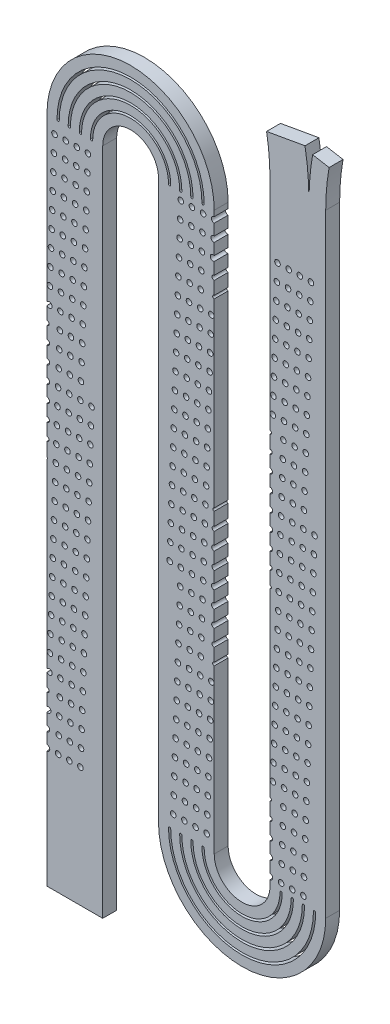
from build123d import *

# Parameters (mm, degrees)
MODEL_R             = 0.005
BOSS_EXTRUDE1_DEPTH = 0.025


with BuildPart() as part:
    # Model → Boss-Extrude1 (new body)
    with BuildSketch(Plane.XY):
        with BuildLine():
            Line((0, 0), (0, 0.01))
            ThreePointArc((0, 0.01), (0.005, 0.015), (0, 0.02))
            Line((0, 0.02), (0, 0.040110983))
            ThreePointArc((0, 0.040110983), (0.004889017, 0.045), (0, 0.049889017))
            Line((0, 0.049889017), (0, 0.070460182))
            ThreePointArc((0, 0.070460182), (0.007095246, 0.075), (0, 0.079539818))
            Line((0, 0.079539818), (0, 0.10111125))
            ThreePointArc((0, 0.10111125), (0.00388875, 0.105), (0, 0.10888875))
            Line((0, 0.10888875), (0, 0.132272405))
            ThreePointArc((0, 0.132272405), (0.009190492, 0.135), (0, 0.137727595))
            Line((0, 0.137727595), (0, 0.462424505))
            ThreePointArc((0, 0.462424505), (0.000714346, 0.465), (0, 0.467575495))
            Line((0, 0.467575495), (0, 0.491190124))
            ThreePointArc((0, 0.491190124), (0.003809876, 0.495), (0, 0.498809876))
            Line((0, 0.498809876), (0, 0.520505324))
            ThreePointArc((0, 0.520505324), (0.004494676, 0.525), (0, 0.529494676))
            Line((0, 0.529494676), (0, 0.550132347))
            ThreePointArc((0, 0.550132347), (0.004867653, 0.555), (0, 0.559867653))
            Line((0, 0.559867653), (0, 0.580000906))
            ThreePointArc((0, 0.580000906), (0.004999094, 0.585), (0, 0.589999094))
            Line((0, 0.589999094), (0, 0.610091557))
            ThreePointArc((0, 0.610091557), (0.004908443, 0.615), (0, 0.619908443))
            Line((0, 0.619908443), (0, 0.640417461))
            ThreePointArc((0, 0.640417461), (0.004582539, 0.645), (0, 0.649582539))
            Line((0, 0.649582539), (0, 0.671036229))
            ThreePointArc((0, 0.671036229), (0.003963771, 0.675), (0, 0.678963771))
            Line((0, 0.678963771), (0, 0.702131505))
            ThreePointArc((0, 0.702131505), (0.009095331, 0.705), (0, 0.707868495))
            Line((0, 0.707868495), (0, 1))
            ThreePointArc((0, 1), (0.15, 1.15), (0.3, 1))
            Line((0.3, 1), (0.3, 0.99))
            ThreePointArc((0.3, 0.99), (0.295, 0.985), (0.3, 0.98))
            Line((0.3, 0.98), (0.3, 0.959889017))
            ThreePointArc((0.3, 0.959889017), (0.293952377, 0.955), (0.3, 0.950110983))
            Line((0.3, 0.950110983), (0.3, 0.929539818))
            ThreePointArc((0.3, 0.929539818), (0.292904754, 0.925), (0.3, 0.920460182))
            Line((0.3, 0.920460182), (0.3, 0.89888875))
            ThreePointArc((0.3, 0.89888875), (0.29611125, 0.895), (0.3, 0.89111125))
            Line((0.3, 0.89111125), (0.3, 0.867727595))
            ThreePointArc((0.3, 0.867727595), (0.297272405, 0.865), (0.3, 0.862272405))
            Line((0.3, 0.862272405), (0.3, 0.537575495))
            ThreePointArc((0.3, 0.537575495), (0.297424505, 0.535), (0.3, 0.532424505))
            Line((0.3, 0.532424505), (0.3, 0.508809876))
            ThreePointArc((0.3, 0.508809876), (0.296190124, 0.505), (0.3, 0.501190124))
            Line((0.3, 0.501190124), (0.3, 0.479494676))
            ThreePointArc((0.3, 0.479494676), (0.295505324, 0.475), (0.3, 0.470505324))
            Line((0.3, 0.470505324), (0.3, 0.449867653))
            ThreePointArc((0.3, 0.449867653), (0.296142784, 0.445), (0.3, 0.440132347))
            Line((0.3, 0.440132347), (0.3, 0.419999094))
            ThreePointArc((0.3, 0.419999094), (0.295000906, 0.415), (0.3, 0.410000906))
            Line((0.3, 0.410000906), (0.3, 0.389908443))
            ThreePointArc((0.3, 0.389908443), (0.295091557, 0.385), (0.3, 0.380091557))
            Line((0.3, 0.380091557), (0.3, 0.359582539))
            ThreePointArc((0.3, 0.359582539), (0.295417461, 0.355), (0.3, 0.350417461))
            Line((0.3, 0.350417461), (0.3, 0.328963771))
            ThreePointArc((0.3, 0.328963771), (0.296036229, 0.325), (0.3, 0.321036229))
            Line((0.3, 0.321036229), (0.3, 0.297868495))
            ThreePointArc((0.3, 0.297868495), (0.297131505, 0.295), (0.3, 0.292131505))
            Line((0.3, 0.292131505), (0.3, 0))
            ThreePointArc((0.3, 0), (0.35, -0.05), (0.4, 0))
            Line((0.4, 0), (0.4, 0.01))
            ThreePointArc((0.4, 0.01), (0.405, 0.015), (0.4, 0.02))
            Line((0.4, 0.02), (0.4, 0.040110983))
            ThreePointArc((0.4, 0.040110983), (0.404889017, 0.045), (0.4, 0.049889017))
            Line((0.4, 0.049889017), (0.4, 0.070460182))
            ThreePointArc((0.4, 0.070460182), (0.404539818, 0.075), (0.4, 0.079539818))
            Line((0.4, 0.079539818), (0.4, 0.10111125))
            ThreePointArc((0.4, 0.10111125), (0.40388875, 0.105), (0.4, 0.10888875))
            Line((0.4, 0.10888875), (0.4, 0.132272405))
            ThreePointArc((0.4, 0.132272405), (0.402727595, 0.135), (0.4, 0.137727595))
            Line((0.4, 0.137727595), (0.4, 0.462424505))
            ThreePointArc((0.4, 0.462424505), (0.402575495, 0.465), (0.4, 0.467575495))
            Line((0.4, 0.467575495), (0.4, 0.491190124))
            ThreePointArc((0.4, 0.491190124), (0.403809876, 0.495), (0.4, 0.498809876))
            Line((0.4, 0.498809876), (0.4, 0.520505324))
            ThreePointArc((0.4, 0.520505324), (0.404494676, 0.525), (0.4, 0.529494676))
            Line((0.4, 0.529494676), (0.4, 0.550132347))
            ThreePointArc((0.4, 0.550132347), (0.404867653, 0.555), (0.4, 0.559867653))
            Line((0.4, 0.559867653), (0.4, 0.580000906))
            ThreePointArc((0.4, 0.580000906), (0.404904839, 0.585), (0.4, 0.589999094))
            Line((0.4, 0.589999094), (0.4, 0.610091557))
            ThreePointArc((0.4, 0.610091557), (0.404908443, 0.615), (0.4, 0.619908443))
            Line((0.4, 0.619908443), (0.4, 0.640417461))
            ThreePointArc((0.4, 0.640417461), (0.404582539, 0.645), (0.4, 0.649582539))
            Line((0.4, 0.649582539), (0.4, 0.671036229))
            ThreePointArc((0.4, 0.671036229), (0.403963771, 0.675), (0.4, 0.678963771))
            Line((0.4, 0.678963771), (0.4, 0.702131505))
            ThreePointArc((0.4, 0.702131505), (0.402868495, 0.705), (0.4, 0.707868495))
            Line((0.4, 0.707868495), (0.4, 1))
            Line((0.4, 1), (0.4, 1.1))
            ThreePointArc((0.4, 1.1), (0.398477879, 1.134862297), (0.393923101, 1.169459271))
            Line((0.393923101, 1.169459271), (0.462859644, 1.181614644))
            ThreePointArc((0.462859644, 1.181614644), (0.468211508, 1.140963199), (0.47, 1.1))
            ThreePointArc((0.47, 1.1), (0.47163628, 1.137476969), (0.476532666, 1.174668716))
            Line((0.476532666, 1.174668716), (0.506076899, 1.169459271))
            ThreePointArc((0.506076899, 1.169459271), (0.501522121, 1.134862297), (0.5, 1.1))
            Line((0.5, 1.1), (0.5, 1))
            Line((0.5, 1), (0.5, 0))
            ThreePointArc((0.5, 0), (0.35, -0.15), (0.2, 0))
            Line((0.2, 0), (0.2, 1))
            ThreePointArc((0.2, 1), (0.15, 1.05), (0.1, 1))
            Line((0.1, 1), (0.1, 0))
            Line((0.1, 0), (0.1, -0.2))
            Line((0.1, -0.2), (0, -0.2))
            Line((0, -0.2), (0, 0))
        make_face()
        with Locations((0.02, 0.015)):
            Circle(MODEL_R, mode=Mode.SUBTRACT)
        with Locations((0.04, 0.015)):
            Circle(MODEL_R, mode=Mode.SUBTRACT)
        with Locations((0.06, 0.015)):
            Circle(MODEL_R, mode=Mode.SUBTRACT)
        with Locations((0.021047623, 0.045)):
            Circle(MODEL_R, mode=Mode.SUBTRACT)
        with Locations((0.041047623, 0.045)):
            Circle(MODEL_R, mode=Mode.SUBTRACT)
        with Locations((0.061047623, 0.045)):
            Circle(MODEL_R, mode=Mode.SUBTRACT)
        with Locations((0.022095246, 0.075)):
            Circle(MODEL_R, mode=Mode.SUBTRACT)
        with Locations((0.042095246, 0.075)):
            Circle(MODEL_R, mode=Mode.SUBTRACT)
        with Locations((0.062095246, 0.075)):
            Circle(MODEL_R, mode=Mode.SUBTRACT)
        with Locations((0.023142869, 0.105)):
            Circle(MODEL_R, mode=Mode.SUBTRACT)
        with Locations((0.043142869, 0.105)):
            Circle(MODEL_R, mode=Mode.SUBTRACT)
        with Locations((0.063142869, 0.105)):
            Circle(MODEL_R, mode=Mode.SUBTRACT)
        with Locations((0.024190492, 0.135)):
            Circle(MODEL_R, mode=Mode.SUBTRACT)
        with Locations((0.044190492, 0.135)):
            Circle(MODEL_R, mode=Mode.SUBTRACT)
        with Locations((0.064190492, 0.135)):
            Circle(MODEL_R, mode=Mode.SUBTRACT)
        with Locations((0.005238115, 0.165)):
            Circle(MODEL_R, mode=Mode.SUBTRACT)
        with Locations((0.025238115, 0.165)):
            Circle(MODEL_R, mode=Mode.SUBTRACT)
        with Locations((0.045238115, 0.165)):
            Circle(MODEL_R, mode=Mode.SUBTRACT)
        with Locations((0.065238115, 0.165)):
            Circle(MODEL_R, mode=Mode.SUBTRACT)
        with Locations((0.006285739, 0.195)):
            Circle(MODEL_R, mode=Mode.SUBTRACT)
        with Locations((0.026285739, 0.195)):
            Circle(MODEL_R, mode=Mode.SUBTRACT)
        with Locations((0.046285739, 0.195)):
            Circle(MODEL_R, mode=Mode.SUBTRACT)
        with Locations((0.066285739, 0.195)):
            Circle(MODEL_R, mode=Mode.SUBTRACT)
        with Locations((0.007333362, 0.225)):
            Circle(MODEL_R, mode=Mode.SUBTRACT)
        with Locations((0.027333362, 0.225)):
            Circle(MODEL_R, mode=Mode.SUBTRACT)
        with Locations((0.047333362, 0.225)):
            Circle(MODEL_R, mode=Mode.SUBTRACT)
        with Locations((0.067333362, 0.225)):
            Circle(MODEL_R, mode=Mode.SUBTRACT)
        with Locations((0.008380985, 0.255)):
            Circle(MODEL_R, mode=Mode.SUBTRACT)
        with Locations((0.028380985, 0.255)):
            Circle(MODEL_R, mode=Mode.SUBTRACT)
        with Locations((0.048380985, 0.255)):
            Circle(MODEL_R, mode=Mode.SUBTRACT)
        with Locations((0.068380985, 0.255)):
            Circle(MODEL_R, mode=Mode.SUBTRACT)
        with Locations((0.009428608, 0.285)):
            Circle(MODEL_R, mode=Mode.SUBTRACT)
        with Locations((0.029428608, 0.285)):
            Circle(MODEL_R, mode=Mode.SUBTRACT)
        with Locations((0.049428608, 0.285)):
            Circle(MODEL_R, mode=Mode.SUBTRACT)
        with Locations((0.069428608, 0.285)):
            Circle(MODEL_R, mode=Mode.SUBTRACT)
        with Locations((0.010476231, 0.315)):
            Circle(MODEL_R, mode=Mode.SUBTRACT)
        with Locations((0.030476231, 0.315)):
            Circle(MODEL_R, mode=Mode.SUBTRACT)
        with Locations((0.050476231, 0.315)):
            Circle(MODEL_R, mode=Mode.SUBTRACT)
        with Locations((0.070476231, 0.315)):
            Circle(MODEL_R, mode=Mode.SUBTRACT)
        with Locations((0.011523854, 0.345)):
            Circle(MODEL_R, mode=Mode.SUBTRACT)
        with Locations((0.031523854, 0.345)):
            Circle(MODEL_R, mode=Mode.SUBTRACT)
        with Locations((0.051523854, 0.345)):
            Circle(MODEL_R, mode=Mode.SUBTRACT)
        with Locations((0.071523854, 0.345)):
            Circle(MODEL_R, mode=Mode.SUBTRACT)
        with Locations((0.012571477, 0.375)):
            Circle(MODEL_R, mode=Mode.SUBTRACT)
        with Locations((0.032571477, 0.375)):
            Circle(MODEL_R, mode=Mode.SUBTRACT)
        with Locations((0.052571477, 0.375)):
            Circle(MODEL_R, mode=Mode.SUBTRACT)
        with Locations((0.072571477, 0.375)):
            Circle(MODEL_R, mode=Mode.SUBTRACT)
        with Locations((0.0136191, 0.405)):
            Circle(MODEL_R, mode=Mode.SUBTRACT)
        with Locations((0.0336191, 0.405)):
            Circle(MODEL_R, mode=Mode.SUBTRACT)
        with Locations((0.0536191, 0.405)):
            Circle(MODEL_R, mode=Mode.SUBTRACT)
        with Locations((0.0736191, 0.405)):
            Circle(MODEL_R, mode=Mode.SUBTRACT)
        with Locations((0.014666723, 0.435)):
            Circle(MODEL_R, mode=Mode.SUBTRACT)
        with Locations((0.034666723, 0.435)):
            Circle(MODEL_R, mode=Mode.SUBTRACT)
        with Locations((0.054666723, 0.435)):
            Circle(MODEL_R, mode=Mode.SUBTRACT)
        with Locations((0.074666723, 0.435)):
            Circle(MODEL_R, mode=Mode.SUBTRACT)
        with Locations((0.015714346, 0.465)):
            Circle(MODEL_R, mode=Mode.SUBTRACT)
        with Locations((0.035714346, 0.465)):
            Circle(MODEL_R, mode=Mode.SUBTRACT)
        with Locations((0.055714346, 0.465)):
            Circle(MODEL_R, mode=Mode.SUBTRACT)
        with Locations((0.075714346, 0.465)):
            Circle(MODEL_R, mode=Mode.SUBTRACT)
        with Locations((0.016761969, 0.495)):
            Circle(MODEL_R, mode=Mode.SUBTRACT)
        with Locations((0.036761969, 0.495)):
            Circle(MODEL_R, mode=Mode.SUBTRACT)
        with Locations((0.056761969, 0.495)):
            Circle(MODEL_R, mode=Mode.SUBTRACT)
        with Locations((0.076761969, 0.495)):
            Circle(MODEL_R, mode=Mode.SUBTRACT)
        with Locations((0.017809592, 0.525)):
            Circle(MODEL_R, mode=Mode.SUBTRACT)
        with Locations((0.037809592, 0.525)):
            Circle(MODEL_R, mode=Mode.SUBTRACT)
        with Locations((0.057809592, 0.525)):
            Circle(MODEL_R, mode=Mode.SUBTRACT)
        with Locations((0.077809592, 0.525)):
            Circle(MODEL_R, mode=Mode.SUBTRACT)
        with Locations((0.018857216, 0.555)):
            Circle(MODEL_R, mode=Mode.SUBTRACT)
        with Locations((0.038857216, 0.555)):
            Circle(MODEL_R, mode=Mode.SUBTRACT)
        with Locations((0.058857216, 0.555)):
            Circle(MODEL_R, mode=Mode.SUBTRACT)
        with Locations((0.078857216, 0.555)):
            Circle(MODEL_R, mode=Mode.SUBTRACT)
        with Locations((0.019904839, 0.585)):
            Circle(MODEL_R, mode=Mode.SUBTRACT)
        with Locations((0.039904839, 0.585)):
            Circle(MODEL_R, mode=Mode.SUBTRACT)
        with Locations((0.059904839, 0.585)):
            Circle(MODEL_R, mode=Mode.SUBTRACT)
        with Locations((0.079904839, 0.585)):
            Circle(MODEL_R, mode=Mode.SUBTRACT)
        with Locations((0.020952462, 0.615)):
            Circle(MODEL_R, mode=Mode.SUBTRACT)
        with Locations((0.040952462, 0.615)):
            Circle(MODEL_R, mode=Mode.SUBTRACT)
        with Locations((0.060952462, 0.615)):
            Circle(MODEL_R, mode=Mode.SUBTRACT)
        with Locations((0.022000085, 0.645)):
            Circle(MODEL_R, mode=Mode.SUBTRACT)
        with Locations((0.042000085, 0.645)):
            Circle(MODEL_R, mode=Mode.SUBTRACT)
        with Locations((0.062000085, 0.645)):
            Circle(MODEL_R, mode=Mode.SUBTRACT)
        with Locations((0.023047708, 0.675)):
            Circle(MODEL_R, mode=Mode.SUBTRACT)
        with Locations((0.043047708, 0.675)):
            Circle(MODEL_R, mode=Mode.SUBTRACT)
        with Locations((0.063047708, 0.675)):
            Circle(MODEL_R, mode=Mode.SUBTRACT)
        with Locations((0.024095331, 0.705)):
            Circle(MODEL_R, mode=Mode.SUBTRACT)
        with Locations((0.044095331, 0.705)):
            Circle(MODEL_R, mode=Mode.SUBTRACT)
        with Locations((0.064095331, 0.705)):
            Circle(MODEL_R, mode=Mode.SUBTRACT)
        with Locations((0.005142954, 0.735)):
            Circle(MODEL_R, mode=Mode.SUBTRACT)
        with Locations((0.025142954, 0.735)):
            Circle(MODEL_R, mode=Mode.SUBTRACT)
        with Locations((0.045142954, 0.735)):
            Circle(MODEL_R, mode=Mode.SUBTRACT)
        with Locations((0.065142954, 0.735)):
            Circle(MODEL_R, mode=Mode.SUBTRACT)
        with Locations((0.006190577, 0.765)):
            Circle(MODEL_R, mode=Mode.SUBTRACT)
        with Locations((0.026190577, 0.765)):
            Circle(MODEL_R, mode=Mode.SUBTRACT)
        with Locations((0.046190577, 0.765)):
            Circle(MODEL_R, mode=Mode.SUBTRACT)
        with Locations((0.066190577, 0.765)):
            Circle(MODEL_R, mode=Mode.SUBTRACT)
        with Locations((0.0072382, 0.795)):
            Circle(MODEL_R, mode=Mode.SUBTRACT)
        with Locations((0.0272382, 0.795)):
            Circle(MODEL_R, mode=Mode.SUBTRACT)
        with Locations((0.0472382, 0.795)):
            Circle(MODEL_R, mode=Mode.SUBTRACT)
        with Locations((0.0672382, 0.795)):
            Circle(MODEL_R, mode=Mode.SUBTRACT)
        with Locations((0.008285823, 0.825)):
            Circle(MODEL_R, mode=Mode.SUBTRACT)
        with Locations((0.028285823, 0.825)):
            Circle(MODEL_R, mode=Mode.SUBTRACT)
        with Locations((0.048285823, 0.825)):
            Circle(MODEL_R, mode=Mode.SUBTRACT)
        with Locations((0.068285823, 0.825)):
            Circle(MODEL_R, mode=Mode.SUBTRACT)
        with Locations((0.009333446, 0.855)):
            Circle(MODEL_R, mode=Mode.SUBTRACT)
        with Locations((0.029333446, 0.855)):
            Circle(MODEL_R, mode=Mode.SUBTRACT)
        with Locations((0.049333446, 0.855)):
            Circle(MODEL_R, mode=Mode.SUBTRACT)
        with Locations((0.069333446, 0.855)):
            Circle(MODEL_R, mode=Mode.SUBTRACT)
        with Locations((0.010381069, 0.885)):
            Circle(MODEL_R, mode=Mode.SUBTRACT)
        with Locations((0.030381069, 0.885)):
            Circle(MODEL_R, mode=Mode.SUBTRACT)
        with Locations((0.050381069, 0.885)):
            Circle(MODEL_R, mode=Mode.SUBTRACT)
        with Locations((0.070381069, 0.885)):
            Circle(MODEL_R, mode=Mode.SUBTRACT)
        with Locations((0.011428693, 0.915)):
            Circle(MODEL_R, mode=Mode.SUBTRACT)
        with Locations((0.031428693, 0.915)):
            Circle(MODEL_R, mode=Mode.SUBTRACT)
        with Locations((0.051428693, 0.915)):
            Circle(MODEL_R, mode=Mode.SUBTRACT)
        with Locations((0.071428693, 0.915)):
            Circle(MODEL_R, mode=Mode.SUBTRACT)
        with Locations((0.012476316, 0.945)):
            Circle(MODEL_R, mode=Mode.SUBTRACT)
        with Locations((0.032476316, 0.945)):
            Circle(MODEL_R, mode=Mode.SUBTRACT)
        with Locations((0.052476316, 0.945)):
            Circle(MODEL_R, mode=Mode.SUBTRACT)
        with Locations((0.072476316, 0.945)):
            Circle(MODEL_R, mode=Mode.SUBTRACT)
        with Locations((0.013523939, 0.975)):
            Circle(MODEL_R, mode=Mode.SUBTRACT)
        with Locations((0.033523939, 0.975)):
            Circle(MODEL_R, mode=Mode.SUBTRACT)
        with Locations((0.053523939, 0.975)):
            Circle(MODEL_R, mode=Mode.SUBTRACT)
        with Locations((0.073523939, 0.975)):
            Circle(MODEL_R, mode=Mode.SUBTRACT)
        with Locations((0.28, 0.985)):
            Circle(MODEL_R, mode=Mode.SUBTRACT)
        with Locations((0.26, 0.985)):
            Circle(MODEL_R, mode=Mode.SUBTRACT)
        with Locations((0.24, 0.985)):
            Circle(MODEL_R, mode=Mode.SUBTRACT)
        with Locations((0.278952377, 0.955)):
            Circle(MODEL_R, mode=Mode.SUBTRACT)
        with Locations((0.258952377, 0.955)):
            Circle(MODEL_R, mode=Mode.SUBTRACT)
        with Locations((0.238952377, 0.955)):
            Circle(MODEL_R, mode=Mode.SUBTRACT)
        with Locations((0.277904754, 0.925)):
            Circle(MODEL_R, mode=Mode.SUBTRACT)
        with Locations((0.257904754, 0.925)):
            Circle(MODEL_R, mode=Mode.SUBTRACT)
        with Locations((0.237904754, 0.925)):
            Circle(MODEL_R, mode=Mode.SUBTRACT)
        with Locations((0.276857131, 0.895)):
            Circle(MODEL_R, mode=Mode.SUBTRACT)
        with Locations((0.256857131, 0.895)):
            Circle(MODEL_R, mode=Mode.SUBTRACT)
        with Locations((0.236857131, 0.895)):
            Circle(MODEL_R, mode=Mode.SUBTRACT)
        with Locations((0.275809508, 0.865)):
            Circle(MODEL_R, mode=Mode.SUBTRACT)
        with Locations((0.255809508, 0.865)):
            Circle(MODEL_R, mode=Mode.SUBTRACT)
        with Locations((0.235809508, 0.865)):
            Circle(MODEL_R, mode=Mode.SUBTRACT)
        with Locations((0.294761885, 0.835)):
            Circle(MODEL_R, mode=Mode.SUBTRACT)
        with Locations((0.274761885, 0.835)):
            Circle(MODEL_R, mode=Mode.SUBTRACT)
        with Locations((0.254761885, 0.835)):
            Circle(MODEL_R, mode=Mode.SUBTRACT)
        with Locations((0.234761885, 0.835)):
            Circle(MODEL_R, mode=Mode.SUBTRACT)
        with Locations((0.293714261, 0.805)):
            Circle(MODEL_R, mode=Mode.SUBTRACT)
        with Locations((0.273714261, 0.805)):
            Circle(MODEL_R, mode=Mode.SUBTRACT)
        with Locations((0.253714261, 0.805)):
            Circle(MODEL_R, mode=Mode.SUBTRACT)
        with Locations((0.233714261, 0.805)):
            Circle(MODEL_R, mode=Mode.SUBTRACT)
        with Locations((0.292666638, 0.775)):
            Circle(MODEL_R, mode=Mode.SUBTRACT)
        with Locations((0.272666638, 0.775)):
            Circle(MODEL_R, mode=Mode.SUBTRACT)
        with Locations((0.252666638, 0.775)):
            Circle(MODEL_R, mode=Mode.SUBTRACT)
        with Locations((0.232666638, 0.775)):
            Circle(MODEL_R, mode=Mode.SUBTRACT)
        with Locations((0.291619015, 0.745)):
            Circle(MODEL_R, mode=Mode.SUBTRACT)
        with Locations((0.271619015, 0.745)):
            Circle(MODEL_R, mode=Mode.SUBTRACT)
        with Locations((0.251619015, 0.745)):
            Circle(MODEL_R, mode=Mode.SUBTRACT)
        with Locations((0.231619015, 0.745)):
            Circle(MODEL_R, mode=Mode.SUBTRACT)
        with Locations((0.290571392, 0.715)):
            Circle(MODEL_R, mode=Mode.SUBTRACT)
        with Locations((0.270571392, 0.715)):
            Circle(MODEL_R, mode=Mode.SUBTRACT)
        with Locations((0.250571392, 0.715)):
            Circle(MODEL_R, mode=Mode.SUBTRACT)
        with Locations((0.230571392, 0.715)):
            Circle(MODEL_R, mode=Mode.SUBTRACT)
        with Locations((0.289523769, 0.685)):
            Circle(MODEL_R, mode=Mode.SUBTRACT)
        with Locations((0.269523769, 0.685)):
            Circle(MODEL_R, mode=Mode.SUBTRACT)
        with Locations((0.249523769, 0.685)):
            Circle(MODEL_R, mode=Mode.SUBTRACT)
        with Locations((0.229523769, 0.685)):
            Circle(MODEL_R, mode=Mode.SUBTRACT)
        with Locations((0.288476146, 0.655)):
            Circle(MODEL_R, mode=Mode.SUBTRACT)
        with Locations((0.268476146, 0.655)):
            Circle(MODEL_R, mode=Mode.SUBTRACT)
        with Locations((0.248476146, 0.655)):
            Circle(MODEL_R, mode=Mode.SUBTRACT)
        with Locations((0.228476146, 0.655)):
            Circle(MODEL_R, mode=Mode.SUBTRACT)
        with Locations((0.287428523, 0.625)):
            Circle(MODEL_R, mode=Mode.SUBTRACT)
        with Locations((0.267428523, 0.625)):
            Circle(MODEL_R, mode=Mode.SUBTRACT)
        with Locations((0.247428523, 0.625)):
            Circle(MODEL_R, mode=Mode.SUBTRACT)
        with Locations((0.227428523, 0.625)):
            Circle(MODEL_R, mode=Mode.SUBTRACT)
        with Locations((0.2863809, 0.595)):
            Circle(MODEL_R, mode=Mode.SUBTRACT)
        with Locations((0.2663809, 0.595)):
            Circle(MODEL_R, mode=Mode.SUBTRACT)
        with Locations((0.2463809, 0.595)):
            Circle(MODEL_R, mode=Mode.SUBTRACT)
        with Locations((0.2263809, 0.595)):
            Circle(MODEL_R, mode=Mode.SUBTRACT)
        with Locations((0.285333277, 0.565)):
            Circle(MODEL_R, mode=Mode.SUBTRACT)
        with Locations((0.265333277, 0.565)):
            Circle(MODEL_R, mode=Mode.SUBTRACT)
        with Locations((0.245333277, 0.565)):
            Circle(MODEL_R, mode=Mode.SUBTRACT)
        with Locations((0.225333277, 0.565)):
            Circle(MODEL_R, mode=Mode.SUBTRACT)
        with Locations((0.284285654, 0.535)):
            Circle(MODEL_R, mode=Mode.SUBTRACT)
        with Locations((0.264285654, 0.535)):
            Circle(MODEL_R, mode=Mode.SUBTRACT)
        with Locations((0.244285654, 0.535)):
            Circle(MODEL_R, mode=Mode.SUBTRACT)
        with Locations((0.224285654, 0.535)):
            Circle(MODEL_R, mode=Mode.SUBTRACT)
        with Locations((0.283238031, 0.505)):
            Circle(MODEL_R, mode=Mode.SUBTRACT)
        with Locations((0.263238031, 0.505)):
            Circle(MODEL_R, mode=Mode.SUBTRACT)
        with Locations((0.243238031, 0.505)):
            Circle(MODEL_R, mode=Mode.SUBTRACT)
        with Locations((0.223238031, 0.505)):
            Circle(MODEL_R, mode=Mode.SUBTRACT)
        with Locations((0.282190408, 0.475)):
            Circle(MODEL_R, mode=Mode.SUBTRACT)
        with Locations((0.262190408, 0.475)):
            Circle(MODEL_R, mode=Mode.SUBTRACT)
        with Locations((0.242190408, 0.475)):
            Circle(MODEL_R, mode=Mode.SUBTRACT)
        with Locations((0.222190408, 0.475)):
            Circle(MODEL_R, mode=Mode.SUBTRACT)
        with Locations((0.281142784, 0.445)):
            Circle(MODEL_R, mode=Mode.SUBTRACT)
        with Locations((0.261142784, 0.445)):
            Circle(MODEL_R, mode=Mode.SUBTRACT)
        with Locations((0.241142784, 0.445)):
            Circle(MODEL_R, mode=Mode.SUBTRACT)
        with Locations((0.221142784, 0.445)):
            Circle(MODEL_R, mode=Mode.SUBTRACT)
        with Locations((0.280095161, 0.415)):
            Circle(MODEL_R, mode=Mode.SUBTRACT)
        with Locations((0.260095161, 0.415)):
            Circle(MODEL_R, mode=Mode.SUBTRACT)
        with Locations((0.240095161, 0.415)):
            Circle(MODEL_R, mode=Mode.SUBTRACT)
        with Locations((0.220095161, 0.415)):
            Circle(MODEL_R, mode=Mode.SUBTRACT)
        with Locations((0.279047538, 0.385)):
            Circle(MODEL_R, mode=Mode.SUBTRACT)
        with Locations((0.259047538, 0.385)):
            Circle(MODEL_R, mode=Mode.SUBTRACT)
        with Locations((0.239047538, 0.385)):
            Circle(MODEL_R, mode=Mode.SUBTRACT)
        with Locations((0.277999915, 0.355)):
            Circle(MODEL_R, mode=Mode.SUBTRACT)
        with Locations((0.257999915, 0.355)):
            Circle(MODEL_R, mode=Mode.SUBTRACT)
        with Locations((0.237999915, 0.355)):
            Circle(MODEL_R, mode=Mode.SUBTRACT)
        with Locations((0.276952292, 0.325)):
            Circle(MODEL_R, mode=Mode.SUBTRACT)
        with Locations((0.256952292, 0.325)):
            Circle(MODEL_R, mode=Mode.SUBTRACT)
        with Locations((0.236952292, 0.325)):
            Circle(MODEL_R, mode=Mode.SUBTRACT)
        with Locations((0.275904669, 0.295)):
            Circle(MODEL_R, mode=Mode.SUBTRACT)
        with Locations((0.255904669, 0.295)):
            Circle(MODEL_R, mode=Mode.SUBTRACT)
        with Locations((0.235904669, 0.295)):
            Circle(MODEL_R, mode=Mode.SUBTRACT)
        with Locations((0.294857046, 0.265)):
            Circle(MODEL_R, mode=Mode.SUBTRACT)
        with Locations((0.274857046, 0.265)):
            Circle(MODEL_R, mode=Mode.SUBTRACT)
        with Locations((0.254857046, 0.265)):
            Circle(MODEL_R, mode=Mode.SUBTRACT)
        with Locations((0.234857046, 0.265)):
            Circle(MODEL_R, mode=Mode.SUBTRACT)
        with Locations((0.293809423, 0.235)):
            Circle(MODEL_R, mode=Mode.SUBTRACT)
        with Locations((0.273809423, 0.235)):
            Circle(MODEL_R, mode=Mode.SUBTRACT)
        with Locations((0.253809423, 0.235)):
            Circle(MODEL_R, mode=Mode.SUBTRACT)
        with Locations((0.233809423, 0.235)):
            Circle(MODEL_R, mode=Mode.SUBTRACT)
        with Locations((0.2927618, 0.205)):
            Circle(MODEL_R, mode=Mode.SUBTRACT)
        with Locations((0.2727618, 0.205)):
            Circle(MODEL_R, mode=Mode.SUBTRACT)
        with Locations((0.2527618, 0.205)):
            Circle(MODEL_R, mode=Mode.SUBTRACT)
        with Locations((0.2327618, 0.205)):
            Circle(MODEL_R, mode=Mode.SUBTRACT)
        with Locations((0.291714177, 0.175)):
            Circle(MODEL_R, mode=Mode.SUBTRACT)
        with Locations((0.271714177, 0.175)):
            Circle(MODEL_R, mode=Mode.SUBTRACT)
        with Locations((0.251714177, 0.175)):
            Circle(MODEL_R, mode=Mode.SUBTRACT)
        with Locations((0.231714177, 0.175)):
            Circle(MODEL_R, mode=Mode.SUBTRACT)
        with Locations((0.290666554, 0.145)):
            Circle(MODEL_R, mode=Mode.SUBTRACT)
        with Locations((0.270666554, 0.145)):
            Circle(MODEL_R, mode=Mode.SUBTRACT)
        with Locations((0.250666554, 0.145)):
            Circle(MODEL_R, mode=Mode.SUBTRACT)
        with Locations((0.230666554, 0.145)):
            Circle(MODEL_R, mode=Mode.SUBTRACT)
        with Locations((0.289618931, 0.115)):
            Circle(MODEL_R, mode=Mode.SUBTRACT)
        with Locations((0.269618931, 0.115)):
            Circle(MODEL_R, mode=Mode.SUBTRACT)
        with Locations((0.249618931, 0.115)):
            Circle(MODEL_R, mode=Mode.SUBTRACT)
        with Locations((0.229618931, 0.115)):
            Circle(MODEL_R, mode=Mode.SUBTRACT)
        with Locations((0.288571307, 0.085)):
            Circle(MODEL_R, mode=Mode.SUBTRACT)
        with Locations((0.268571307, 0.085)):
            Circle(MODEL_R, mode=Mode.SUBTRACT)
        with Locations((0.248571307, 0.085)):
            Circle(MODEL_R, mode=Mode.SUBTRACT)
        with Locations((0.228571307, 0.085)):
            Circle(MODEL_R, mode=Mode.SUBTRACT)
        with Locations((0.287523684, 0.055)):
            Circle(MODEL_R, mode=Mode.SUBTRACT)
        with Locations((0.267523684, 0.055)):
            Circle(MODEL_R, mode=Mode.SUBTRACT)
        with Locations((0.247523684, 0.055)):
            Circle(MODEL_R, mode=Mode.SUBTRACT)
        with Locations((0.227523684, 0.055)):
            Circle(MODEL_R, mode=Mode.SUBTRACT)
        with Locations((0.286476061, 0.025)):
            Circle(MODEL_R, mode=Mode.SUBTRACT)
        with Locations((0.266476061, 0.025)):
            Circle(MODEL_R, mode=Mode.SUBTRACT)
        with Locations((0.246476061, 0.025)):
            Circle(MODEL_R, mode=Mode.SUBTRACT)
        with Locations((0.226476061, 0.025)):
            Circle(MODEL_R, mode=Mode.SUBTRACT)
        with Locations((0.42, 0.015)):
            Circle(MODEL_R, mode=Mode.SUBTRACT)
        with Locations((0.44, 0.015)):
            Circle(MODEL_R, mode=Mode.SUBTRACT)
        with Locations((0.46, 0.015)):
            Circle(MODEL_R, mode=Mode.SUBTRACT)
        with Locations((0.421047623, 0.045)):
            Circle(MODEL_R, mode=Mode.SUBTRACT)
        with Locations((0.441047623, 0.045)):
            Circle(MODEL_R, mode=Mode.SUBTRACT)
        with Locations((0.461047623, 0.045)):
            Circle(MODEL_R, mode=Mode.SUBTRACT)
        with Locations((0.422095246, 0.075)):
            Circle(MODEL_R, mode=Mode.SUBTRACT)
        with Locations((0.442095246, 0.075)):
            Circle(MODEL_R, mode=Mode.SUBTRACT)
        with Locations((0.462095246, 0.075)):
            Circle(MODEL_R, mode=Mode.SUBTRACT)
        with Locations((0.423142869, 0.105)):
            Circle(MODEL_R, mode=Mode.SUBTRACT)
        with Locations((0.443142869, 0.105)):
            Circle(MODEL_R, mode=Mode.SUBTRACT)
        with Locations((0.463142869, 0.105)):
            Circle(MODEL_R, mode=Mode.SUBTRACT)
        with Locations((0.424190492, 0.135)):
            Circle(MODEL_R, mode=Mode.SUBTRACT)
        with Locations((0.444190492, 0.135)):
            Circle(MODEL_R, mode=Mode.SUBTRACT)
        with Locations((0.464190492, 0.135)):
            Circle(MODEL_R, mode=Mode.SUBTRACT)
        with Locations((0.405238115, 0.165)):
            Circle(MODEL_R, mode=Mode.SUBTRACT)
        with Locations((0.425238115, 0.165)):
            Circle(MODEL_R, mode=Mode.SUBTRACT)
        with Locations((0.445238115, 0.165)):
            Circle(MODEL_R, mode=Mode.SUBTRACT)
        with Locations((0.465238115, 0.165)):
            Circle(MODEL_R, mode=Mode.SUBTRACT)
        with Locations((0.406285739, 0.195)):
            Circle(MODEL_R, mode=Mode.SUBTRACT)
        with Locations((0.426285739, 0.195)):
            Circle(MODEL_R, mode=Mode.SUBTRACT)
        with Locations((0.446285739, 0.195)):
            Circle(MODEL_R, mode=Mode.SUBTRACT)
        with Locations((0.466285739, 0.195)):
            Circle(MODEL_R, mode=Mode.SUBTRACT)
        with Locations((0.407333362, 0.225)):
            Circle(MODEL_R, mode=Mode.SUBTRACT)
        with Locations((0.427333362, 0.225)):
            Circle(MODEL_R, mode=Mode.SUBTRACT)
        with Locations((0.447333362, 0.225)):
            Circle(MODEL_R, mode=Mode.SUBTRACT)
        with Locations((0.467333362, 0.225)):
            Circle(MODEL_R, mode=Mode.SUBTRACT)
        with Locations((0.408380985, 0.255)):
            Circle(MODEL_R, mode=Mode.SUBTRACT)
        with Locations((0.428380985, 0.255)):
            Circle(MODEL_R, mode=Mode.SUBTRACT)
        with Locations((0.448380985, 0.255)):
            Circle(MODEL_R, mode=Mode.SUBTRACT)
        with Locations((0.468380985, 0.255)):
            Circle(MODEL_R, mode=Mode.SUBTRACT)
        with Locations((0.409428608, 0.285)):
            Circle(MODEL_R, mode=Mode.SUBTRACT)
        with Locations((0.429428608, 0.285)):
            Circle(MODEL_R, mode=Mode.SUBTRACT)
        with Locations((0.449428608, 0.285)):
            Circle(MODEL_R, mode=Mode.SUBTRACT)
        with Locations((0.469428608, 0.285)):
            Circle(MODEL_R, mode=Mode.SUBTRACT)
        with Locations((0.410476231, 0.315)):
            Circle(MODEL_R, mode=Mode.SUBTRACT)
        with Locations((0.430476231, 0.315)):
            Circle(MODEL_R, mode=Mode.SUBTRACT)
        with Locations((0.450476231, 0.315)):
            Circle(MODEL_R, mode=Mode.SUBTRACT)
        with Locations((0.470476231, 0.315)):
            Circle(MODEL_R, mode=Mode.SUBTRACT)
        with Locations((0.411523854, 0.345)):
            Circle(MODEL_R, mode=Mode.SUBTRACT)
        with Locations((0.431523854, 0.345)):
            Circle(MODEL_R, mode=Mode.SUBTRACT)
        with Locations((0.451523854, 0.345)):
            Circle(MODEL_R, mode=Mode.SUBTRACT)
        with Locations((0.471523854, 0.345)):
            Circle(MODEL_R, mode=Mode.SUBTRACT)
        with Locations((0.412571477, 0.375)):
            Circle(MODEL_R, mode=Mode.SUBTRACT)
        with Locations((0.432571477, 0.375)):
            Circle(MODEL_R, mode=Mode.SUBTRACT)
        with Locations((0.452571477, 0.375)):
            Circle(MODEL_R, mode=Mode.SUBTRACT)
        with Locations((0.472571477, 0.375)):
            Circle(MODEL_R, mode=Mode.SUBTRACT)
        with Locations((0.4136191, 0.405)):
            Circle(MODEL_R, mode=Mode.SUBTRACT)
        with Locations((0.4336191, 0.405)):
            Circle(MODEL_R, mode=Mode.SUBTRACT)
        with Locations((0.4536191, 0.405)):
            Circle(MODEL_R, mode=Mode.SUBTRACT)
        with Locations((0.4736191, 0.405)):
            Circle(MODEL_R, mode=Mode.SUBTRACT)
        with Locations((0.414666723, 0.435)):
            Circle(MODEL_R, mode=Mode.SUBTRACT)
        with Locations((0.434666723, 0.435)):
            Circle(MODEL_R, mode=Mode.SUBTRACT)
        with Locations((0.454666723, 0.435)):
            Circle(MODEL_R, mode=Mode.SUBTRACT)
        with Locations((0.474666723, 0.435)):
            Circle(MODEL_R, mode=Mode.SUBTRACT)
        with Locations((0.415714346, 0.465)):
            Circle(MODEL_R, mode=Mode.SUBTRACT)
        with Locations((0.435714346, 0.465)):
            Circle(MODEL_R, mode=Mode.SUBTRACT)
        with Locations((0.455714346, 0.465)):
            Circle(MODEL_R, mode=Mode.SUBTRACT)
        with Locations((0.475714346, 0.465)):
            Circle(MODEL_R, mode=Mode.SUBTRACT)
        with Locations((0.416761969, 0.495)):
            Circle(MODEL_R, mode=Mode.SUBTRACT)
        with Locations((0.436761969, 0.495)):
            Circle(MODEL_R, mode=Mode.SUBTRACT)
        with Locations((0.456761969, 0.495)):
            Circle(MODEL_R, mode=Mode.SUBTRACT)
        with Locations((0.476761969, 0.495)):
            Circle(MODEL_R, mode=Mode.SUBTRACT)
        with Locations((0.417809592, 0.525)):
            Circle(MODEL_R, mode=Mode.SUBTRACT)
        with Locations((0.437809592, 0.525)):
            Circle(MODEL_R, mode=Mode.SUBTRACT)
        with Locations((0.457809592, 0.525)):
            Circle(MODEL_R, mode=Mode.SUBTRACT)
        with Locations((0.477809592, 0.525)):
            Circle(MODEL_R, mode=Mode.SUBTRACT)
        with Locations((0.418857216, 0.555)):
            Circle(MODEL_R, mode=Mode.SUBTRACT)
        with Locations((0.438857216, 0.555)):
            Circle(MODEL_R, mode=Mode.SUBTRACT)
        with Locations((0.458857216, 0.555)):
            Circle(MODEL_R, mode=Mode.SUBTRACT)
        with Locations((0.478857216, 0.555)):
            Circle(MODEL_R, mode=Mode.SUBTRACT)
        with Locations((0.419904839, 0.585)):
            Circle(MODEL_R, mode=Mode.SUBTRACT)
        with Locations((0.439904839, 0.585)):
            Circle(MODEL_R, mode=Mode.SUBTRACT)
        with Locations((0.459904839, 0.585)):
            Circle(MODEL_R, mode=Mode.SUBTRACT)
        with Locations((0.479904839, 0.585)):
            Circle(MODEL_R, mode=Mode.SUBTRACT)
        with Locations((0.420952462, 0.615)):
            Circle(MODEL_R, mode=Mode.SUBTRACT)
        with Locations((0.440952462, 0.615)):
            Circle(MODEL_R, mode=Mode.SUBTRACT)
        with Locations((0.460952462, 0.615)):
            Circle(MODEL_R, mode=Mode.SUBTRACT)
        with Locations((0.422000085, 0.645)):
            Circle(MODEL_R, mode=Mode.SUBTRACT)
        with Locations((0.442000085, 0.645)):
            Circle(MODEL_R, mode=Mode.SUBTRACT)
        with Locations((0.462000085, 0.645)):
            Circle(MODEL_R, mode=Mode.SUBTRACT)
        with Locations((0.423047708, 0.675)):
            Circle(MODEL_R, mode=Mode.SUBTRACT)
        with Locations((0.443047708, 0.675)):
            Circle(MODEL_R, mode=Mode.SUBTRACT)
        with Locations((0.463047708, 0.675)):
            Circle(MODEL_R, mode=Mode.SUBTRACT)
        with Locations((0.424095331, 0.705)):
            Circle(MODEL_R, mode=Mode.SUBTRACT)
        with Locations((0.444095331, 0.705)):
            Circle(MODEL_R, mode=Mode.SUBTRACT)
        with Locations((0.464095331, 0.705)):
            Circle(MODEL_R, mode=Mode.SUBTRACT)
        with Locations((0.405142954, 0.735)):
            Circle(MODEL_R, mode=Mode.SUBTRACT)
        with Locations((0.425142954, 0.735)):
            Circle(MODEL_R, mode=Mode.SUBTRACT)
        with Locations((0.445142954, 0.735)):
            Circle(MODEL_R, mode=Mode.SUBTRACT)
        with Locations((0.465142954, 0.735)):
            Circle(MODEL_R, mode=Mode.SUBTRACT)
        with Locations((0.406190577, 0.765)):
            Circle(MODEL_R, mode=Mode.SUBTRACT)
        with Locations((0.426190577, 0.765)):
            Circle(MODEL_R, mode=Mode.SUBTRACT)
        with Locations((0.446190577, 0.765)):
            Circle(MODEL_R, mode=Mode.SUBTRACT)
        with Locations((0.466190577, 0.765)):
            Circle(MODEL_R, mode=Mode.SUBTRACT)
        with Locations((0.4072382, 0.795)):
            Circle(MODEL_R, mode=Mode.SUBTRACT)
        with Locations((0.4272382, 0.795)):
            Circle(MODEL_R, mode=Mode.SUBTRACT)
        with Locations((0.4472382, 0.795)):
            Circle(MODEL_R, mode=Mode.SUBTRACT)
        with Locations((0.4672382, 0.795)):
            Circle(MODEL_R, mode=Mode.SUBTRACT)
        with Locations((0.408285823, 0.825)):
            Circle(MODEL_R, mode=Mode.SUBTRACT)
        with Locations((0.428285823, 0.825)):
            Circle(MODEL_R, mode=Mode.SUBTRACT)
        with Locations((0.448285823, 0.825)):
            Circle(MODEL_R, mode=Mode.SUBTRACT)
        with Locations((0.468285823, 0.825)):
            Circle(MODEL_R, mode=Mode.SUBTRACT)
        with Locations((0.409333446, 0.855)):
            Circle(MODEL_R, mode=Mode.SUBTRACT)
        with Locations((0.429333446, 0.855)):
            Circle(MODEL_R, mode=Mode.SUBTRACT)
        with Locations((0.449333446, 0.855)):
            Circle(MODEL_R, mode=Mode.SUBTRACT)
        with Locations((0.469333446, 0.855)):
            Circle(MODEL_R, mode=Mode.SUBTRACT)
        with Locations((0.410381069, 0.885)):
            Circle(MODEL_R, mode=Mode.SUBTRACT)
        with Locations((0.430381069, 0.885)):
            Circle(MODEL_R, mode=Mode.SUBTRACT)
        with Locations((0.450381069, 0.885)):
            Circle(MODEL_R, mode=Mode.SUBTRACT)
        with Locations((0.470381069, 0.885)):
            Circle(MODEL_R, mode=Mode.SUBTRACT)
        with Locations((0.411428693, 0.915)):
            Circle(MODEL_R, mode=Mode.SUBTRACT)
        with Locations((0.431428693, 0.915)):
            Circle(MODEL_R, mode=Mode.SUBTRACT)
        with Locations((0.451428693, 0.915)):
            Circle(MODEL_R, mode=Mode.SUBTRACT)
        with Locations((0.471428693, 0.915)):
            Circle(MODEL_R, mode=Mode.SUBTRACT)
        with Locations((0.412476316, 0.945)):
            Circle(MODEL_R, mode=Mode.SUBTRACT)
        with Locations((0.432476316, 0.945)):
            Circle(MODEL_R, mode=Mode.SUBTRACT)
        with Locations((0.452476316, 0.945)):
            Circle(MODEL_R, mode=Mode.SUBTRACT)
        with Locations((0.472476316, 0.945)):
            Circle(MODEL_R, mode=Mode.SUBTRACT)
        with Locations((0.413523939, 0.975)):
            Circle(MODEL_R, mode=Mode.SUBTRACT)
        with Locations((0.433523939, 0.975)):
            Circle(MODEL_R, mode=Mode.SUBTRACT)
        with Locations((0.453523939, 0.975)):
            Circle(MODEL_R, mode=Mode.SUBTRACT)
        with Locations((0.473523939, 0.975)):
            Circle(MODEL_R, mode=Mode.SUBTRACT)
        with BuildLine():
            ThreePointArc((0.222, 1), (0.15, 1.072), (0.078, 1))
            ThreePointArc((0.078, 1), (0.08, 0.998), (0.082, 1))
            ThreePointArc((0.082, 1), (0.15, 1.068), (0.218, 1))
            ThreePointArc((0.218, 1), (0.22, 0.998), (0.222, 1))
        make_face(mode=Mode.SUBTRACT)
        with BuildLine():
            ThreePointArc((0.242, 1), (0.15, 1.092), (0.058, 1))
            ThreePointArc((0.058, 1), (0.06, 0.998), (0.062, 1))
            ThreePointArc((0.062, 1), (0.15, 1.088), (0.238, 1))
            ThreePointArc((0.238, 1), (0.24, 0.998), (0.242, 1))
        make_face(mode=Mode.SUBTRACT)
        with BuildLine():
            ThreePointArc((0.262, 1), (0.15, 1.112), (0.038, 1))
            ThreePointArc((0.038, 1), (0.04, 0.998), (0.042, 1))
            ThreePointArc((0.042, 1), (0.15, 1.108), (0.258, 1))
            ThreePointArc((0.258, 1), (0.26, 0.998), (0.262, 1))
        make_face(mode=Mode.SUBTRACT)
        with BuildLine():
            ThreePointArc((0.282, 1), (0.15, 1.132), (0.018, 1))
            ThreePointArc((0.018, 1), (0.02, 0.998), (0.022, 1))
            ThreePointArc((0.022, 1), (0.15, 1.128), (0.278, 1))
            ThreePointArc((0.278, 1), (0.28, 0.998), (0.282, 1))
        make_face(mode=Mode.SUBTRACT)
        with BuildLine():
            ThreePointArc((0.278, 0), (0.35, -0.072), (0.422, 0))
            ThreePointArc((0.422, 0), (0.42, 0.002), (0.418, 0))
            ThreePointArc((0.418, 0), (0.35, -0.068), (0.282, 0))
            ThreePointArc((0.282, 0), (0.28, 0.002), (0.278, 0))
        make_face(mode=Mode.SUBTRACT)
        with BuildLine():
            ThreePointArc((0.258, 0), (0.35, -0.092), (0.442, 0))
            ThreePointArc((0.442, 0), (0.44, 0.002), (0.438, 0))
            ThreePointArc((0.438, 0), (0.35, -0.088), (0.262, 0))
            ThreePointArc((0.262, 0), (0.26, 0.002), (0.258, 0))
        make_face(mode=Mode.SUBTRACT)
        with BuildLine():
            ThreePointArc((0.238, 0), (0.35, -0.112), (0.462, 0))
            ThreePointArc((0.462, 0), (0.46, 0.002), (0.458, 0))
            ThreePointArc((0.458, 0), (0.35, -0.108), (0.242, 0))
            ThreePointArc((0.242, 0), (0.24, 0.002), (0.238, 0))
        make_face(mode=Mode.SUBTRACT)
        with BuildLine():
            ThreePointArc((0.218, 0), (0.35, -0.132), (0.482, 0))
            ThreePointArc((0.482, 0), (0.48, 0.002), (0.478, 0))
            ThreePointArc((0.478, 0), (0.35, -0.128), (0.222, 0))
            ThreePointArc((0.222, 0), (0.22, 0.002), (0.218, 0))
        make_face(mode=Mode.SUBTRACT)
    extrude(amount=BOSS_EXTRUDE1_DEPTH)


solid = part.part
